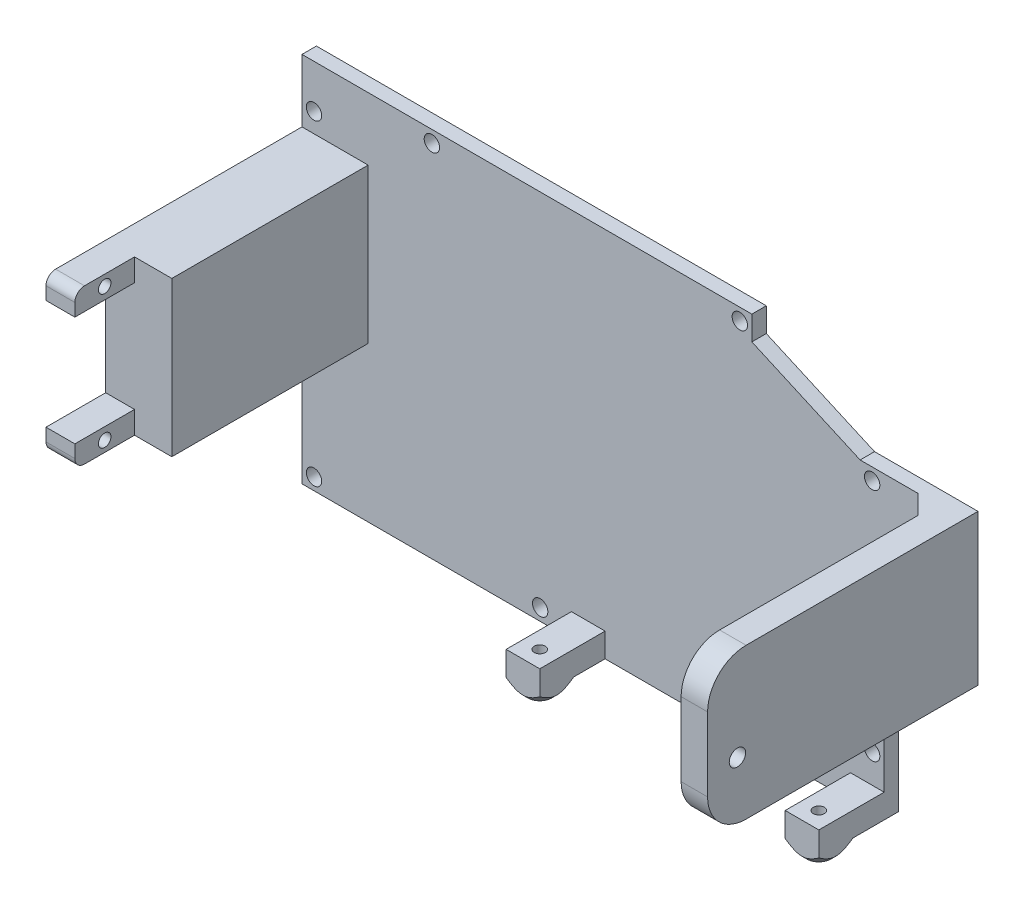
from build123d import *

# Parameters (mm, degrees)
BASE_DEPTH          = 3
SERVO_SUPPORT_DEPTH = 43.8
SKETCH21_W          = 6
SKETCH21_H          = 4.65
SERVO_MOUNTS_DEPTH  = 12.4
SERVO_SCREWS_REACH  = 142.173
SKETCH22_R          = 1.3
FILLET1_R           = 2
SKETCH23_W          = 16.5
SKETCH23_H          = 31.3
SHAFT_SUPPORT_DEPTH = 3
SKETCH24_W          = 5.5
SKETCH24_H          = 31.3
BOSS_EXTRUDE6_DEPTH = 56.2
FILLET2_R           = 8
FILLET3_R           = 8
SHAFT_REACH         = 151.771
SKETCH25_R          = 1.7
SCREWS_REACH        = 107.316
SKETCH26_R          = 1.6
SKETCH26_R_2        = 1.4
SKETCH31_W          = 7
SKETCH31_H          = 13.5765
BOSS_EXTRUDE8_DEPTH = 5
SKETCH30_R          = 2.5
BOSS_EXTRUDE9_DEPTH = 2.5
CUT_EXTRUDE1_REACH  = 122.29
SKETCH32_R          = 1.15
CHAMFER1_SIZE       = 2.5
CHAMFER2_SIZE       = 4


with BuildPart() as part:
    # Sketch19 → Base (new body)
    with BuildSketch(Plane.XY):
        Polygon((61.5, 19.3), (56.5, 19.3), (34, 29.3), (34, 34.3), (-59.5, 34.3), (-59.5, -43), (61.5, -43), align=None)
    extrude(amount=BASE_DEPTH)

    # Sketch20 → Servo support (add)
    with BuildSketch(Plane.XY):
        Polygon((-53.298152188, -10.85), (-55.448152188, -10.85), (-59.5, -10.85), (-59.5, 21.25), (-55.448152188, 21.25), (-53.298152188, 21.25), (-45.748152188, 21.25), (-45.748152188, 8.609473612), (-45.748152188, -10.85), align=None)
    extrude(amount=SERVO_SUPPORT_DEPTH)

    # Sketch21 → Servo mounts (add)
    with BuildSketch(Plane.XY.offset(43.8)):
        with Locations((-56.5, -8.525)):
            Rectangle(SKETCH21_W, SKETCH21_H)
        with Locations((-56.5, 18.925)):
            Rectangle(SKETCH21_W, SKETCH21_H)
    extrude(amount=SERVO_MOUNTS_DEPTH)

    # Sketch22 → Servo screws (cut, up to next)
    with BuildSketch(Plane.ZY.offset(59.5), mode=Mode.PRIVATE) as servo_screws_sk1:
        with Locations(Location((50, -8.65, 0), (0, 0, 270))):
            Circle(SKETCH22_R)
    servo_screws_tool1 = extrude(servo_screws_sk1.sketch, amount=-SERVO_SCREWS_REACH, mode=Mode.PRIVATE) & part.part
    # Sketch22 → Servo screws (cut, up to next)
    with BuildSketch(Plane.ZY.offset(59.5), mode=Mode.PRIVATE) as servo_screws_sk2:
        with Locations(Location((50, 19.05, 0), (0, 0, 270))):
            Circle(SKETCH22_R)
    servo_screws_tool2 = extrude(servo_screws_sk2.sketch, amount=-SERVO_SCREWS_REACH, mode=Mode.PRIVATE) & part.part
    add(servo_screws_tool1.solids().sort_by_distance((-59.5, -8.65, 50))[0], mode=Mode.SUBTRACT)
    add(servo_screws_tool2.solids().sort_by_distance((-59.5, 19.05, 50))[0], mode=Mode.SUBTRACT)

    # Fillet1
    fillet1_edges = [part.edges().sort_by_distance(p)[0] for p in [
        (-56.5, 21.25, 56.2),
        (-56.5, -10.85, 56.2),
    ]]
    fillet(fillet1_edges, radius=FILLET1_R)

    # Sketch23 → Shaft support (add)
    with BuildSketch(Plane.XY):
        with Locations((69.75, 3.65)):
            Rectangle(SKETCH23_W, SKETCH23_H)
    extrude(amount=SHAFT_SUPPORT_DEPTH)

    # Sketch24 → Boss-Extrude6 (add)
    with BuildSketch(Plane.XY):
        with Locations((75.25, 3.65)):
            Rectangle(SKETCH24_W, SKETCH24_H)
    extrude(amount=BOSS_EXTRUDE6_DEPTH)

    # Fillet2
    fillet2_edges = [part.edges().sort_by_distance(p)[0] for p in [
        (61.5, -12, 1.5),
    ]]
    fillet(fillet2_edges, radius=FILLET2_R)

    # Fillet3
    fillet3_edges = [part.edges().sort_by_distance(p)[0] for p in [
        (75.25, 19.3, 56.2),
        (75.25, -12, 56.2),
    ]]
    fillet(fillet3_edges, radius=FILLET3_R)

    # Sketch25 → Shaft (cut, up to next)
    with BuildSketch(Plane.ZY.offset(-72.5), mode=Mode.PRIVATE) as shaft_sk1:
        with Locations((50, 0)):
            Circle(SKETCH25_R)
    shaft_tool1 = extrude(shaft_sk1.sketch, amount=-SHAFT_REACH, mode=Mode.PRIVATE) & part.part
    add(shaft_tool1.solids().sort_by_distance((72.5, 0, 50))[0], mode=Mode.SUBTRACT)

    # Sketch26 → Screws (cut, up to next)
    with BuildSketch(Plane.XY, mode=Mode.PRIVATE) as screws_sk1:
        with Locations((-57, -40.5)):
            Circle(SKETCH26_R)
    screws_tool1 = extrude(screws_sk1.sketch, amount=SCREWS_REACH, mode=Mode.PRIVATE) & part.part
    # Sketch26 → Screws (cut, up to next)
    with BuildSketch(Plane.XY, mode=Mode.PRIVATE) as screws_sk2:
        with Locations((-10, -40.5)):
            Circle(SKETCH26_R)
    screws_tool2 = extrude(screws_sk2.sketch, amount=SCREWS_REACH, mode=Mode.PRIVATE) & part.part
    # Sketch26 → Screws (cut, up to next)
    with BuildSketch(Plane.XY, mode=Mode.PRIVATE) as screws_sk3:
        with Locations((59, -32)):
            Circle(SKETCH26_R)
    screws_tool3 = extrude(screws_sk3.sketch, amount=SCREWS_REACH, mode=Mode.PRIVATE) & part.part
    # Sketch26 → Screws (cut, up to next)
    with BuildSketch(Plane.XY, mode=Mode.PRIVATE) as screws_sk4:
        with Locations((59, 16.8)):
            Circle(SKETCH26_R)
    screws_tool4 = extrude(screws_sk4.sketch, amount=SCREWS_REACH, mode=Mode.PRIVATE) & part.part
    # Sketch26 → Screws (cut, up to next)
    with BuildSketch(Plane.XY, mode=Mode.PRIVATE) as screws_sk5:
        with Locations((31.5, 31.8)):
            Circle(SKETCH26_R)
    screws_tool5 = extrude(screws_sk5.sketch, amount=SCREWS_REACH, mode=Mode.PRIVATE) & part.part
    # Sketch26 → Screws (cut, up to next)
    with BuildSketch(Plane.XY, mode=Mode.PRIVATE) as screws_sk6:
        with Locations((-32.5, 31.8)):
            Circle(SKETCH26_R)
    screws_tool6 = extrude(screws_sk6.sketch, amount=SCREWS_REACH, mode=Mode.PRIVATE) & part.part
    # Sketch26 → Screws (cut, up to next)
    with BuildSketch(Plane.XY, mode=Mode.PRIVATE) as screws_sk7:
        with Locations((-57, 25.3)):
            Circle(SKETCH26_R)
    screws_tool7 = extrude(screws_sk7.sketch, amount=SCREWS_REACH, mode=Mode.PRIVATE) & part.part
    # Sketch26 → Screws (cut, up to next)
    with BuildSketch(Plane.XY, mode=Mode.PRIVATE) as screws_sk8:
        with Locations((-57, -14.5)):
            Circle(SKETCH26_R_2)
    screws_tool8 = extrude(screws_sk8.sketch, amount=SCREWS_REACH, mode=Mode.PRIVATE) & part.part
    # Sketch26 → Screws (cut, up to next)
    with BuildSketch(Plane.XY, mode=Mode.PRIVATE) as screws_sk9:
        with Locations((45.5, -40.5)):
            Circle(SKETCH26_R_2)
    screws_tool9 = extrude(screws_sk9.sketch, amount=SCREWS_REACH, mode=Mode.PRIVATE) & part.part
    add(screws_tool1.solids().sort_by_distance((-57, -40.5, 0))[0], mode=Mode.SUBTRACT)
    add(screws_tool2.solids().sort_by_distance((-10, -40.5, 0))[0], mode=Mode.SUBTRACT)
    add(screws_tool3.solids().sort_by_distance((59, -32, 0))[0], mode=Mode.SUBTRACT)
    add(screws_tool4.solids().sort_by_distance((59, 16.8, 0))[0], mode=Mode.SUBTRACT)
    add(screws_tool5.solids().sort_by_distance((31.5, 31.8, 0))[0], mode=Mode.SUBTRACT)
    add(screws_tool6.solids().sort_by_distance((-32.5, 31.8, 0))[0], mode=Mode.SUBTRACT)
    add(screws_tool7.solids().sort_by_distance((-57, 25.3, 0))[0], mode=Mode.SUBTRACT)
    add(screws_tool8.solids().sort_by_distance((-57, -14.5, 0))[0], mode=Mode.SUBTRACT)
    add(screws_tool9.solids().sort_by_distance((45.5, -40.5, 0))[0], mode=Mode.SUBTRACT)

    # Sketch31 → Boss-Extrude8 (add)
    with BuildSketch(Plane.XZ.offset(43)):
        with Locations((0, 9.78825)):
            Rectangle(SKETCH31_W, SKETCH31_H)
        with Locations((58, 9.78825)):
            Rectangle(SKETCH31_W, SKETCH31_H)
    extrude(amount=-BOSS_EXTRUDE8_DEPTH)

    # Sketch30 → Boss-Extrude9 (add)
    with BuildSketch(Plane.XZ.offset(43)):
        with Locations(Location((0, 13.0765, 0), (0, 0, 180))):
            Circle(SKETCH30_R)
        with Locations(Location((58, 13.0765, 0), (0, 0, 180))):
            Circle(SKETCH30_R)
    extrude(amount=BOSS_EXTRUDE9_DEPTH)

    # Sketch32 → Cut-Extrude1 (cut, up to next)
    with BuildSketch(Plane(origin=(0, -38, 0), x_dir=(1, 0, 0), z_dir=(0, 1, 0)), mode=Mode.PRIVATE) as cut_extrude1_sk1:
        with Locations(Location((0, -13.0765, 0), (0, 0, 270))):
            Circle(SKETCH32_R)
    cut_extrude1_tool1 = extrude(cut_extrude1_sk1.sketch, amount=-CUT_EXTRUDE1_REACH, mode=Mode.PRIVATE) & part.part
    # Sketch32 → Cut-Extrude1 (cut, up to next)
    with BuildSketch(Plane(origin=(0, -38, 0), x_dir=(1, 0, 0), z_dir=(0, 1, 0)), mode=Mode.PRIVATE) as cut_extrude1_sk2:
        with Locations(Location((58, -13.0765, 0), (0, 0, 270))):
            Circle(SKETCH32_R)
    cut_extrude1_tool2 = extrude(cut_extrude1_sk2.sketch, amount=-CUT_EXTRUDE1_REACH, mode=Mode.PRIVATE) & part.part
    add(cut_extrude1_tool1.solids().sort_by_distance((0, -38, 13.0765))[0], mode=Mode.SUBTRACT)
    add(cut_extrude1_tool2.solids().sort_by_distance((58, -38, 13.0765))[0], mode=Mode.SUBTRACT)

    # Chamfer1
    # the kernel refuses this chamfer: 2.5 mm, written as the material it adds along each edge
    with BuildSketch(Plane(origin=(58, -43, 13.0765), x_dir=(-1, 0, 0), z_dir=(0, 0, 1))) as chamfer1_piece_1_section:
        Polygon((2.5 + CHAMFER1_SIZE, 0), (2.5, CHAMFER1_SIZE), (2.5, 0), align=None)
    chamfer1_piece_1 = revolve(axis=Axis((58, -43, 13.0765), (0, -1, 0)), mode=Mode.PRIVATE)
    chamfer1_piece_1 = split(chamfer1_piece_1, bisect_by=Plane(origin=(61.5, -43.330528144, 9.079752975), z_dir=(-1, 0, 0)), keep=Keep.TOP, mode=Mode.PRIVATE)
    chamfer1_piece_1 = split(chamfer1_piece_1, bisect_by=Plane(origin=(54.5, -43.330528144, 9.079752975), z_dir=(1, 0, 0)), keep=Keep.TOP, mode=Mode.PRIVATE)
    chamfer1_piece_1 = split(chamfer1_piece_1, bisect_by=Plane(origin=(55.692477029, -43.330528144, 16.5765), z_dir=(0, 0, -1)), keep=Keep.TOP, mode=Mode.PRIVATE)
    chamfer1_piece_1 = split(chamfer1_piece_1, bisect_by=Plane(origin=(55.692477029, -45.5, 9.079752975), z_dir=(0, 1, 0)), keep=Keep.TOP, mode=Mode.PRIVATE)
    add(chamfer1_piece_1)
    with BuildSketch(Plane(origin=(0, -43, 13.0765), x_dir=(-1, 0, 0), z_dir=(0, 0, 1))) as chamfer1_piece_2_section:
        Polygon((2.5 + CHAMFER1_SIZE, 0), (2.5, CHAMFER1_SIZE), (2.5, 0), align=None)
    chamfer1_piece_2 = revolve(axis=Axis((0, -43, 13.0765), (0, -1, 0)), mode=Mode.PRIVATE)
    chamfer1_piece_2 = split(chamfer1_piece_2, bisect_by=Plane(origin=(-3.5, -43.330528144, 9.079752976), z_dir=(1, 0, 0)), keep=Keep.TOP, mode=Mode.PRIVATE)
    chamfer1_piece_2 = split(chamfer1_piece_2, bisect_by=Plane(origin=(-2.30752297, -43.330528144, 16.5765), z_dir=(0, 0, -1)), keep=Keep.TOP, mode=Mode.PRIVATE)
    chamfer1_piece_2 = split(chamfer1_piece_2, bisect_by=Plane(origin=(3.5, -43.330528144, 9.079752976), z_dir=(-1, 0, 0)), keep=Keep.TOP, mode=Mode.PRIVATE)
    chamfer1_piece_2 = split(chamfer1_piece_2, bisect_by=Plane(origin=(-2.30752297, -45.5, 9.079752976), z_dir=(0, 1, 0)), keep=Keep.TOP, mode=Mode.PRIVATE)
    add(chamfer1_piece_2)

    # Chamfer2
    chamfer2_edges = [part.edges().sort_by_distance(p)[0] for p in [
        (72.5, 3.65, 3),
    ]]
    chamfer(chamfer2_edges, length=CHAMFER2_SIZE)


solid = part.part
